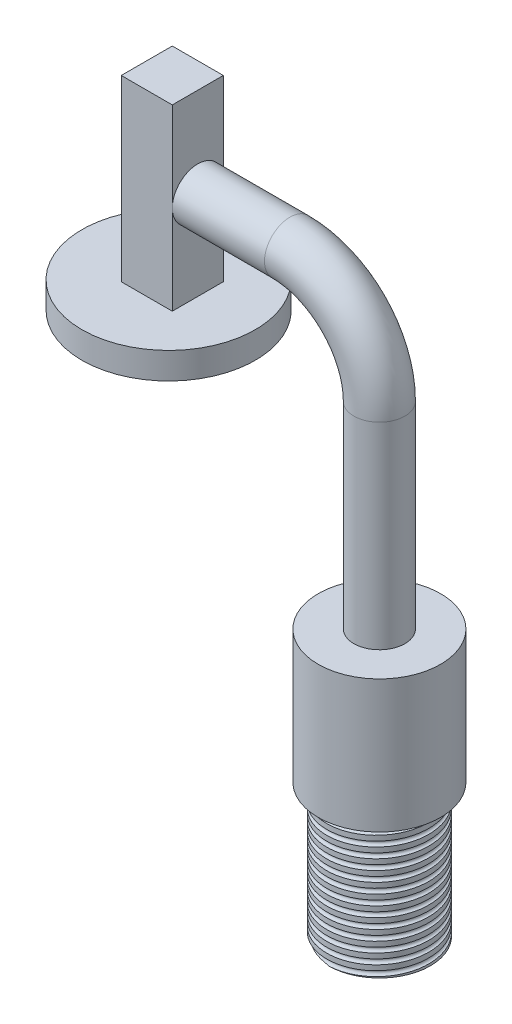
from build123d import *

# Parameters (mm, degrees)
SKETCH1_R           = 50
BOSS_EXTRUDE1_DEPTH = 131
CUT_SWEEP3_PITCH    = 10
SKETCH47_R          = 60
BOSS_EXTRUDE2_DEPTH = 130
SWEEP1_PROFILE_R    = 25
SKETCH76_W          = 50
SKETCH76_H          = 175.130930369
BOSS_EXTRUDE3_DEPTH = 50
SKETCH79_R          = 85
BOSS_EXTRUDE4_DEPTH = 26
CUT_EXTRUDE1_DEPTH  = 18


with BuildPart() as part:
    # Sketch1 → Boss-Extrude1 (new body)
    with BuildSketch(Plane(origin=(0, 0, 0), x_dir=(1, 0, 0), z_dir=(0, 1, 0))):
        with Locations(Location((0, 0, 0), (0, 0, 270))):
            Circle(SKETCH1_R)
    extrude(amount=BOSS_EXTRUDE1_DEPTH)

    # Cut-Sweep3: arcs per turn and ends read off the stored shape
    # Cut-Sweep3: the profile of Cut-Sweep3 profile screwed along a right-hand helix through 13.5 turns, 16 arcs to a turn; built about Z, then put on its axis
    cut_sweep3_z = Axis((0, 0, 0), (0, 0, 1))
    cut_sweep3_corners = [(50, -0.079537188, -7.501265553), (52.5, 0, -10), (50, 0.079537188, -12.498734447), (47.5, 0, -10)]
    with BuildLine(mode=Mode.PRIVATE) as cut_sweep3_profile:
        ThreePointArc((50, -0.079537188, -7.501265553), (51.767766953, -0.056241285, -8.233127928), (52.5, 0, -10))
        ThreePointArc((52.5, 0, -10), (51.767766953, 0.056241285, -11.766872072), (50, 0.079537188, -12.498734447))
        ThreePointArc((50, 0.079537188, -12.498734447), (48.232233047, 0.056241285, -11.766872072), (47.5, 0, -10))
        ThreePointArc((47.5, 0, -10), (48.232233047, -0.056241285, -8.233127928), (50, -0.079537188, -7.501265553))
    cut_sweep3_cap = Face(cut_sweep3_profile.wire())
    cut_sweep3_arcs = [((50, -0.079537188, -7.501265553), (52.5, -0.079537188, -7.501265553), (52.5, 0, -10), (1, 0.7071067811865476, 1)), ((52.5, 0, -10), (52.5, 0.079537188, -12.498734447), (50, 0.079537188, -12.498734447), (1, 0.7071067811865476, 1)), ((50, 0.079537188, -12.498734447), (47.5, 0.079537188, -12.498734447), (47.5, 0, -10), (1, 0.7071067811865476, 1)), ((47.5, 0, -10), (47.5, -0.079537188, -7.501265553), (50, -0.079537188, -7.501265553), (1, 0.7071067811865476, 1))]  # start, shoulder, end, weights
    cut_sweep3_turn_angles = [0, 11.25, 22.5, 33.75, 45, 56.25, 67.5, 78.75, 90, 101.25, 112.5, 123.75, 135, 146.25, 157.5, 168.75, 180, 191.25, 202.5, 213.75, 225, 236.25, 247.5, 258.75, 270, 281.25, 292.5, 303.75, 315, 326.25, 337.5, 348.75, 360]
    cut_sweep3_turn_weights = [1, 0.9807852804032304, 1, 0.9807852804032304, 1, 0.9807852804032304, 1, 0.9807852804032304, 1, 0.9807852804032304, 1, 0.9807852804032304, 1, 0.9807852804032304, 1, 0.9807852804032304, 1, 0.9807852804032304, 1, 0.9807852804032304, 1, 0.9807852804032304, 1, 0.9807852804032304, 1, 0.9807852804032304, 1, 0.9807852804032304, 1, 0.9807852804032304, 1, 0.9807852804032304, 1]
    cut_sweep3_turn_sides = [Face.make_bezier_surface([[Vector(p[j][0], p[j][1], 0).rotate(cut_sweep3_z, cut_sweep3_turn_angles[2 * i + k]) / cut_sweep3_turn_weights[2 * i + k] + Vector(0, 0, p[j][2] + CUT_SWEEP3_PITCH * cut_sweep3_turn_angles[2 * i + k] / 360) for k in range(3)] for j in range(3)], [[p[3][j] * cut_sweep3_turn_weights[2 * i + k] for k in range(3)] for j in range(3)]) for p in cut_sweep3_arcs for i in range(16)]
    cut_sweep3_last_angles = [4680, 4691.25, 4702.5, 4713.75, 4725, 4736.25, 4747.5, 4758.75, 4770, 4781.25, 4792.5, 4803.75, 4815, 4826.25, 4837.5, 4848.75, 4860]
    cut_sweep3_last_weights = [1, 0.9807852804032304, 1, 0.9807852804032304, 1, 0.9807852804032304, 1, 0.9807852804032304, 1, 0.9807852804032304, 1, 0.9807852804032304, 1, 0.9807852804032304, 1, 0.9807852804032304, 1]
    cut_sweep3_last_sides = [Face.make_bezier_surface([[Vector(p[j][0], p[j][1], 0).rotate(cut_sweep3_z, cut_sweep3_last_angles[2 * i + k]) / cut_sweep3_last_weights[2 * i + k] + Vector(0, 0, p[j][2] + CUT_SWEEP3_PITCH * cut_sweep3_last_angles[2 * i + k] / 360) for k in range(3)] for j in range(3)], [[p[3][j] * cut_sweep3_last_weights[2 * i + k] for k in range(3)] for j in range(3)]) for p in cut_sweep3_arcs for i in range(8)]
    cut_sweep3 = Plane(origin=(0, 0, 0), x_dir=(-1, 0, 0), z_dir=(0, 1, 0)) * Solid(Shell([*[p.moved(Location((0, 0, CUT_SWEEP3_PITCH * i))) for i in range(13) for p in cut_sweep3_turn_sides], *cut_sweep3_last_sides, cut_sweep3_cap, cut_sweep3_cap.rotate(cut_sweep3_z, 4860).moved(Location((0, 0, CUT_SWEEP3_PITCH * 4860 / 360)))]))
    add(cut_sweep3, mode=Mode.SUBTRACT)

    # Sketch47 → Boss-Extrude2 (add)
    with BuildSketch(Plane(origin=(0, 131, 0), x_dir=(1, 0, 0), z_dir=(0, 1, 0))):
        with Locations(Location((0, 0, 0), (0, 0, 270))):
            Circle(SKETCH47_R)
    extrude(amount=BOSS_EXTRUDE2_DEPTH)

    # Sweep1: sweep along a path in Sketch49
    with BuildLine(Plane.XY) as sweep1_path:
        Line((0, 261), (0, 454.168478453))
        ThreePointArc((0, 454.168478453), (-25.667334448, 516.134905387), (-87.633761382, 541.802239835))
        Line((-87.633761382, 541.802239835), (-178.019366415, 541.802239835))
    # Sweep1 profile (on start of the path) → Sweep1 (sweep)
    with BuildSketch(Plane.ZX.offset(261)):
        Circle(SWEEP1_PROFILE_R)
    sweep(path=sweep1_path.line)

    # Sketch76 → Boss-Extrude3 (add)
    with BuildSketch(Plane.ZY.offset(178.019366415)):
        with Locations((0, 541.802239836)):
            Rectangle(SKETCH76_W, SKETCH76_H)
    extrude(amount=BOSS_EXTRUDE3_DEPTH)

    # Sketch79 → Boss-Extrude4 (add)
    with BuildSketch(Plane.XZ.offset(-454.236774651)):
        with Locations(Location((-206.606296099, 0, 0), (0, 0, 90))):
            Circle(SKETCH79_R)
    extrude(amount=BOSS_EXTRUDE4_DEPTH)

    # Sketch80 → Cut-Extrude1 (cut)
    with BuildSketch(Plane.XZ.offset(-428.236774651)):
        with BuildLine():
            Line((-221.333232243, -17.6), (-191.133232243, -17.6))
            ThreePointArc((-191.133232243, -17.6), (-189.36546529, -16.867766953), (-188.633232243, -15.1))
            Line((-188.633232243, -15.1), (-188.633232243, 15.1))
            ThreePointArc((-188.633232243, 15.1), (-189.36546529, 16.867766953), (-191.133232243, 17.6))
            Line((-191.133232243, 17.6), (-221.333232243, 17.6))
            ThreePointArc((-221.333232243, 17.6), (-223.100999196, 16.867766953), (-223.833232243, 15.1))
            Line((-223.833232243, 15.1), (-223.833232243, -15.1))
            ThreePointArc((-223.833232243, -15.1), (-223.100999196, -16.867766953), (-221.333232243, -17.6))
        make_face()
    extrude(amount=-CUT_EXTRUDE1_DEPTH, mode=Mode.SUBTRACT)


solid = part.part
